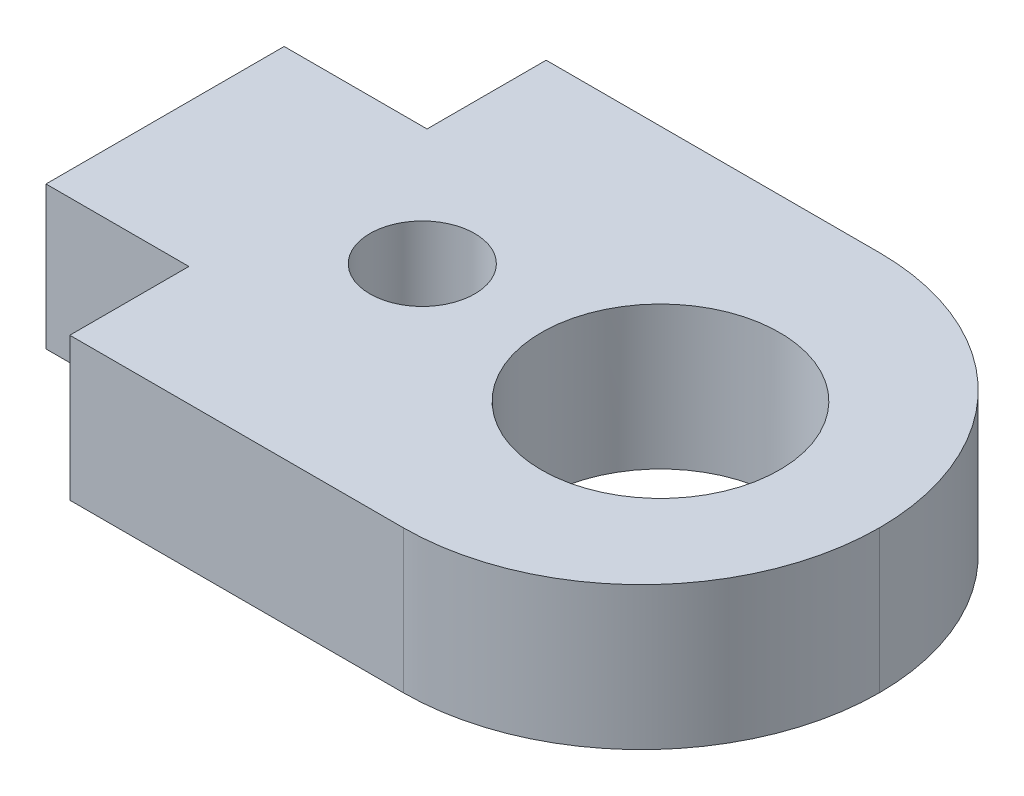
from build123d import *

# Parameters (mm, degrees)
SALIENTE_EXTRUIR1_DEPTH = 3
CROQUIS2_R              = 2.5
CROQUIS2_R_2            = 1.1
CORTAR_EXTRUIR1_DEPTH   = 10
REDONDEO1_R             = 5


with BuildPart() as part:
    # Croquis1 → Saliente-Extruir1 (new body)
    with BuildSketch(Plane(origin=(0, 0, 0), x_dir=(1, 0, 0), z_dir=(0, 1, 0))):
        Polygon((-6, 5), (-6, 2.5), (-9, 2.5), (-9, -2.5), (-6, -2.5), (-6, -5), (6, -5), (6, 5), align=None)
    extrude(amount=SALIENTE_EXTRUIR1_DEPTH)

    # Croquis2 → Cortar-Extruir1 (cut)
    with BuildSketch(Plane(origin=(0, 3, 0), x_dir=(1, 0, 0), z_dir=(0, 1, 0))):
        with Locations(Location((1.4, 0, 0), (0, 0, 270))):
            Circle(CROQUIS2_R)
        with Locations(Location((-3.6, 0, 0), (0, 0, 270))):
            Circle(CROQUIS2_R_2)
    extrude(amount=-CORTAR_EXTRUIR1_DEPTH, mode=Mode.SUBTRACT)

    # Redondeo1
    redondeo1_edges = [part.edges().sort_by_distance(p)[0] for p in [
        (6, 1.5, -5),
        (6, 1.5, 5),
    ]]
    fillet(redondeo1_edges, radius=REDONDEO1_R - 0.0001)  # a hair under: the kernel refuses the full size


solid = part.part
